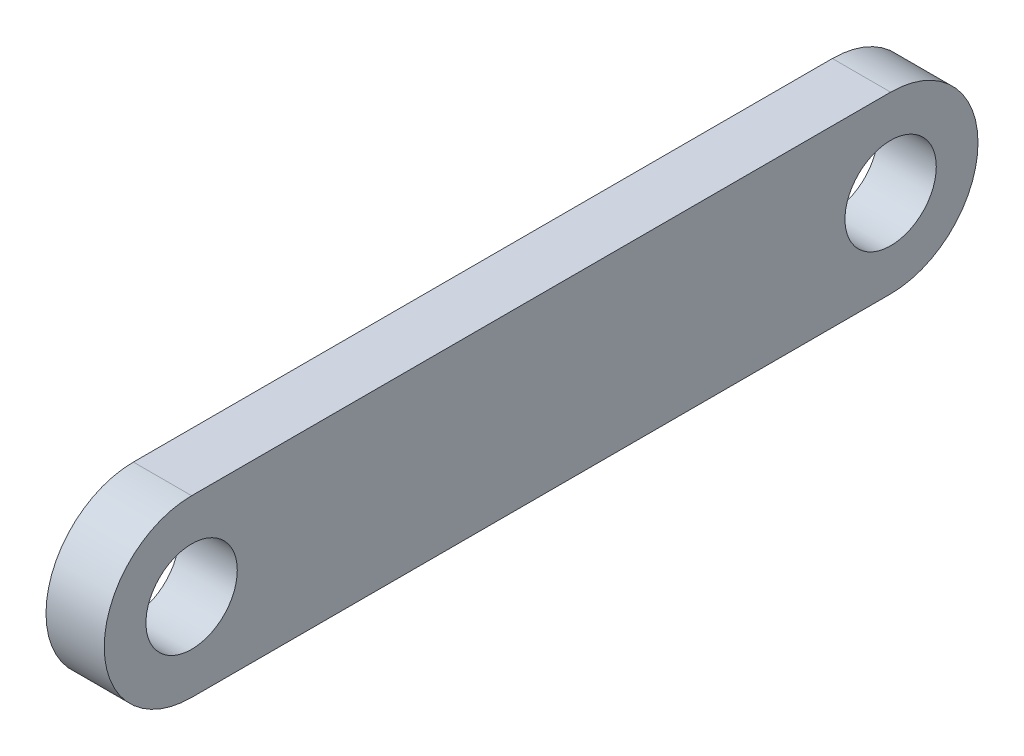
from build123d import *

# Parameters (mm, degrees)
SKETCH1_R           = 2.4892
BOSS_EXTRUDE1_DEPTH = 1.5875


with BuildPart() as part:
    # Sketch1 → Boss-Extrude1 (new, symmetric)
    with BuildSketch(Plane(origin=(0, 0, 0), x_dir=(0, 0, -1), z_dir=(1, 0, 0))):
        with BuildLine():
            Line((0, 4.7625), (38.1, 4.7625))
            ThreePointArc((38.1, 4.7625), (42.8625, 0), (38.1, -4.7625))
            Line((38.1, -4.7625), (0, -4.7625))
            ThreePointArc((0, -4.7625), (-4.7625, 0), (0, 4.7625))
        make_face()
        with Locations((38.1, 0)):
            Circle(SKETCH1_R, mode=Mode.SUBTRACT)
        Circle(SKETCH1_R, mode=Mode.SUBTRACT)
    extrude(amount=BOSS_EXTRUDE1_DEPTH, both=True)


solid = part.part
